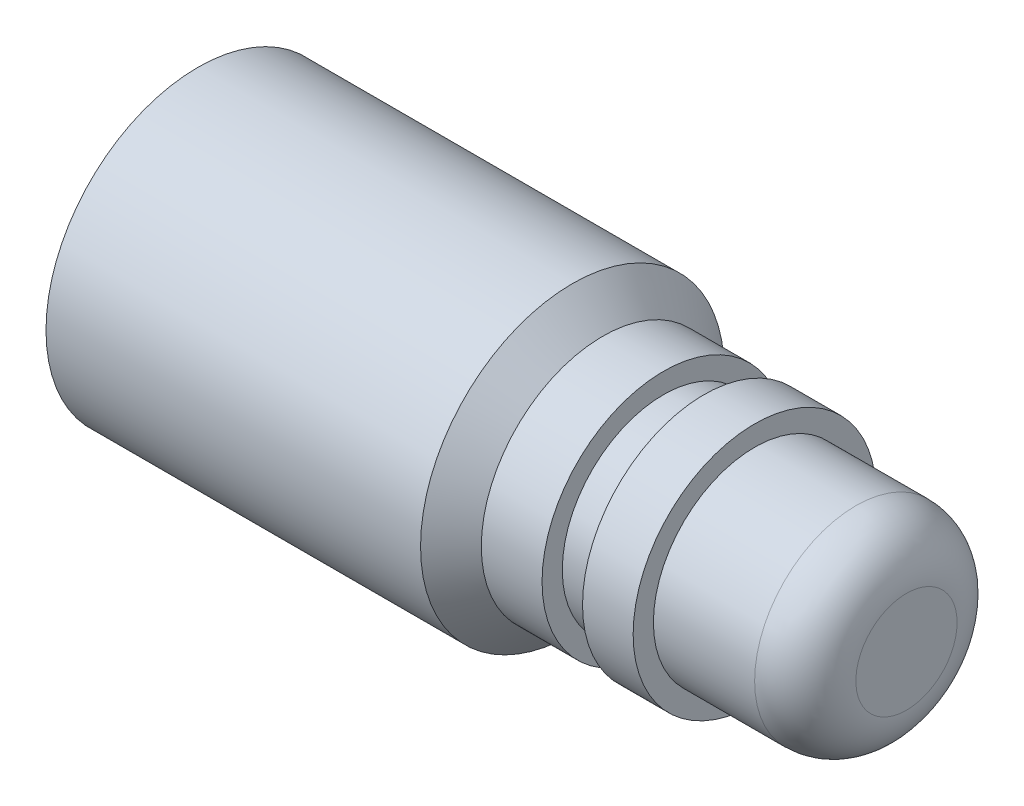
from build123d import *

# Parameters (mm, degrees)
ZAOBLIT1_R    = 5
ZKOSEN_1_SIZE = 3


with BuildPart() as part:
    # Skica1 → Rotovat1 (revolve)
    with BuildSketch(Plane.XY, mode=Mode.PRIVATE) as rotovat1_sk:
        Polygon((0, 15), (0, 0), (70, 0), (70, 10), (55, 10), (55, 12), (50, 12), (50, 10), (46, 10), (46, 12), (40, 12), (40, 15), align=None)
    revolve(rotovat1_sk.sketch.rotate(Axis((-5.449862177, 0, 0), (1, 0, 0)), 90), axis=Axis((-5.449862177, 0, 0), (1, 0, 0)))

    # Zaoblit1
    zaoblit1_edges = [part.edges().sort_by_distance(p)[0] for p in [
        (70, 0, -10),
    ]]
    fillet(zaoblit1_edges, radius=ZAOBLIT1_R)

    # Zkosení1
    zkosen_1_edges = [part.edges().sort_by_distance(p)[0] for p in [
        (40, 0, -15),
    ]]
    chamfer(zkosen_1_edges, length=ZKOSEN_1_SIZE - 0.0001)  # a hair under: the kernel refuses the full size


solid = part.part
